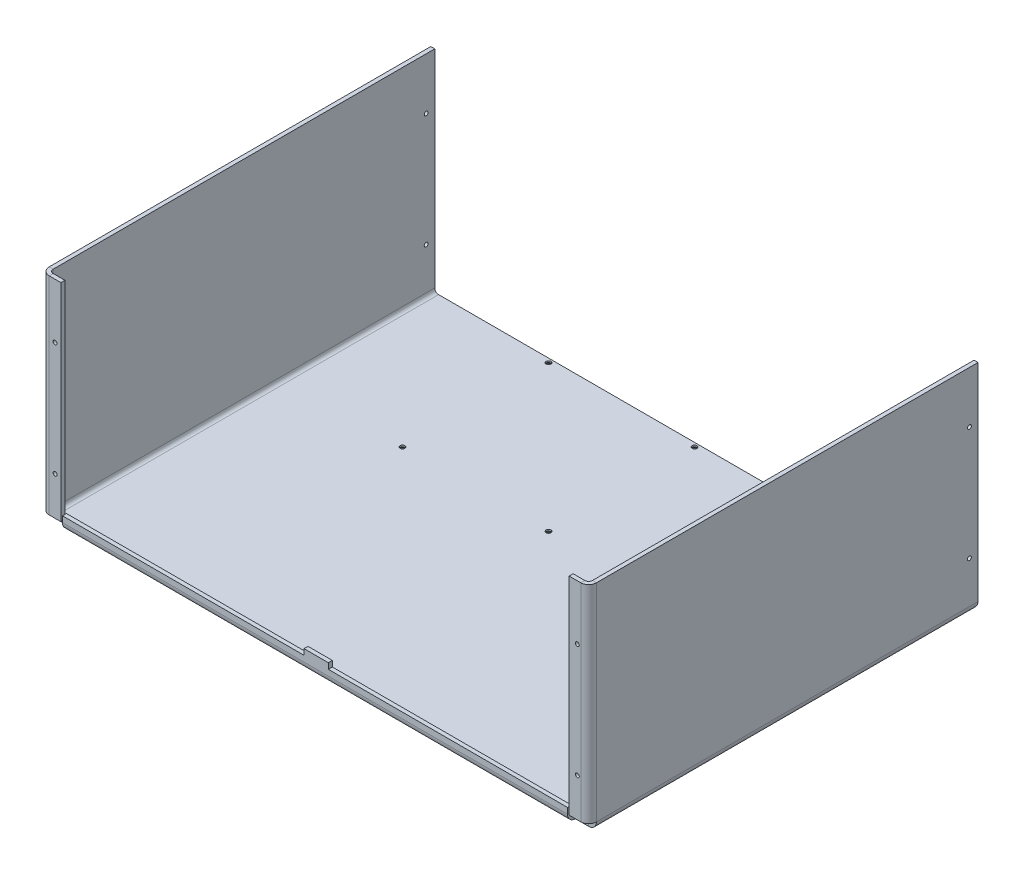
from build123d import *
from OCP.BRepAlgoAPI import BRepAlgoAPI_Cut
from OCP.TopTools import TopTools_ListOfShape

# Parameters (mm, degrees)
BASE_FLANGE1_DEPTH                                = 3.1241999999999996
SKETCHED_START                                    = -372.599383401
SKETCHED_BEND1_DEPTH                              = 304.8
SKETCHED_BEND1_2_DEPTH                            = 304.8
SKETCHED_BEND2_DEPTH                              = 304.8
SKETCHED_BEND2_2_DEPTH                            = 304.8
EDGE_FLANGE1_START                                = -1
EDGE_FLANGE1_DEPTH                                = 169.22392973
EDGE_FLANGE1_2_DEPTH                              = 7.124199914
EDGE_FLANGE1_START_2                              = 6.124199914
EDGE_FLANGE1_3_DEPTH                              = 162.099729816
EDGE_FLANGE2_START                                = -1
EDGE_FLANGE2_DEPTH                                = 169.223930078
EDGE_FLANGE2_2_DEPTH                              = 7.1242
EDGE_FLANGE2_START_2                              = 6.1242
EDGE_FLANGE2_3_DEPTH                              = 162.099730078
CUT_EXTRUDE1_DEPTH                                = 697.5074743358982
CUT_EXTRUDE2_DEPTH                                = 697.5074743358982
EDGE_FLANGE4_START                                = 152.995997641
EDGE_FLANGE4_DEPTH                                = 395.32508
EDGE_FLANGE4_START_2                              = 151.433897641
EDGE_FLANGE4_2_DEPTH                              = 1.5621
EDGE_FLANGE4_START_3                              = 548.321077641
EDGE_FLANGE4_3_DEPTH                              = 1.5621
EDGE_FLANGE4_4_DEPTH                              = 395.32508
SKETCH18_W                                        = 19.05000000000001
SKETCH18_H                                        = 4.495799999999319
TAB1_DEPTH                                        = 3.1241999999999996
CSK_FOR_8_FLAT_HEAD_MACHINE_SCREW_100_D           = 4.4958
CSK_FOR_8_FLAT_HEAD_MACHINE_SCREW_100_CSINK_D     = 8.4328
CSK_FOR_8_FLAT_HEAD_MACHINE_SCREW_100_CSINK_ANGLE = 100
LPATTERN1_COUNT                                   = 2
LPATTERN1_PITCH                                   = 65.99936
LPATTERN1_COUNT_DIR2                              = 2
LPATTERN1_PITCH_DIR2                              = 117.00001999999999
CSK_FOR_6_FLAT_HEAD_MACHINE_SCREW2_D              = 3.7973
CSK_FOR_6_FLAT_HEAD_MACHINE_SCREW2_CSINK_D        = 7.0866
CSK_FOR_6_FLAT_HEAD_MACHINE_SCREW2_CSINK_ANGLE    = 82
LPATTERN3_COUNT                                   = 2
LPATTERN3_PITCH                                   = 114.3
LPATTERN3_COUNT_DIR2                              = 2
LPATTERN3_PITCH_DIR2                              = 114.3
F_40_0_098_DIAMETER_HOLE1_D                       = 3.048
F_40_0_098_DIAMETER_HOLE1_DEPTH                   = 304.8
LPATTERN4_COUNT                                   = 2
LPATTERN4_PITCH                                   = 88.89999999999999
MIRROR2_COPY_1_D                                  = 3.048
MIRROR2_COPY_1_DEPTH                              = 304.8
MIRROR2_COPY_2_D                                  = 3.048
MIRROR2_COPY_2_DEPTH                              = 304.8
MIRROR2_COPY_3_D                                  = 3.048
MIRROR2_COPY_3_DEPTH                              = 304.8
MIRROR2_COPY_4_D                                  = 3.048
MIRROR2_COPY_4_DEPTH                              = 304.8
F_40_0_098_DIAMETER_HOLE2_D                       = 3.048
LPATTERN5_COUNT                                   = 2
LPATTERN5_PITCH                                   = 88.89999999999999


with BuildPart() as part:
    # Base-Flange1: sheet metal written as solids
    # Sketch1 → Base-Flange1 (new body)
    with BuildSketch(Plane(origin=(0, 0, 0), x_dir=(1, 0, 0), z_dir=(0, 1, 0))):
        Polygon((-26.655922359465325, 372.5993834011592), (727.9729976405347, 372.5993834011592), (727.9729976405347, 67.79938340115923), (-26.65592235946532, 67.79938340115915), align=None)
    extrude(amount=BASE_FLANGE1_DEPTH)

    # Sketched Bend1: read off the stored shape, not the designer's step
    # Sketched Bend1 outline → Sketched Bend1 (cut)
    with BuildSketch(Plane.XY.offset(SKETCHED_START)):
        with BuildLine():
            ThreePointArc((142.609937641, 1e-07), (139.516943564, 0.838444419), (137.270853036, 3.1242))
            Line((137.270853036, 3.1242), (-26.655922359, 3.1242))
            Line((-26.655922359, 3.1242), (-26.655922359, 0))
            Line((-26.655922359, 0), (142.609937641, 1e-07))
        make_face()
    extrude(amount=SKETCHED_BEND1_DEPTH, mode=Mode.SUBTRACT)

    # Sketched Bend1 2 outline → Sketched Bend1 2 (add)
    with BuildSketch(Plane.XY.offset(SKETCHED_START)):
        with BuildLine():
            Line((139.60993774, 6.1242), (139.609937641, 168.223930078))
            Line((139.609937641, 168.223930078), (136.485737641, 168.223930078))
            Line((136.485737641, 168.223930078), (136.48573774, 6.1242))
            ThreePointArc((136.48573774, 6.1242), (136.68526694, 4.573683471), (137.270853036, 3.1242))
            Line((137.270853036, 3.1242), (142.609937641, 3.1242001))
            ThreePointArc((142.609937641, 3.1242001), (140.488617368, 4.002879727), (139.60993774, 6.1242))
        make_face()
    extrude(amount=SKETCHED_BEND1_2_DEPTH)

    # Sketched Bend2: read off the stored shape, not the designer's step
    # Sketched Bend2 outline → Sketched Bend2 (cut)
    with BuildSketch(Plane.XY.offset(SKETCHED_START)):
        with BuildLine():
            Line((727.972997641, 3.1242), (564.046222808, 3.1242))
            ThreePointArc((564.046222808, 3.1242), (561.800132084, 0.838444066), (558.707137641, -3.91e-07))
            Line((558.707137641, -3.91e-07), (727.972997641, 0))
            Line((727.972997641, 0), (727.972997641, 3.1242))
        make_face()
    extrude(amount=SKETCHED_BEND2_DEPTH, mode=Mode.SUBTRACT)

    # Sketched Bend2 2 outline → Sketched Bend2 2 (add)
    with BuildSketch(Plane.XY.offset(SKETCHED_START)):
        with BuildLine():
            Line((564.831337641, 168.223930078), (561.707137641, 168.223930078))
            Line((561.707137641, 168.223930078), (561.707138032, 6.1242))
            ThreePointArc((561.707138032, 6.1242), (560.828458261, 4.00287938), (558.707137641, 3.124199609))
            Line((558.707137641, 3.124199609), (564.046222808, 3.1242))
            ThreePointArc((564.046222808, 3.1242), (564.631808851, 4.57368348), (564.831338032, 6.1242))
            Line((564.831338032, 6.1242), (564.831337641, 168.223930078))
        make_face()
    extrude(amount=SKETCHED_BEND2_2_DEPTH)

    # Edge-Flange1: read off the stored shape, not the designer's step
    # Edge-Flange1 outline → Edge-Flange1 (cut)
    with BuildSketch(Plane(origin=(0, 0, 0), x_dir=(1.0, 6.15831459901035e-10, 0), z_dir=(-6.15831459901035e-10, 1.0, 0)).offset(EDGE_FLANGE1_START)):
        with BuildLine():
            Line((142.609937744, 70.923583401), (142.609937641, 73.923583401))
            Line((142.609937641, 73.923583401), (139.609937744, 73.923583401))
            ThreePointArc((139.609937744, 73.923583401), (140.488617401, 71.802263058), (142.609937744, 70.923583401))
        make_face()
        with BuildLine():
            ThreePointArc((142.609937682, 67.799383401), (138.279474373, 69.593120074), (136.485737744, 73.923583401))
            Line((136.485737744, 73.923583401), (136.485737735, 67.799383401))
            Line((136.485737735, 67.799383401), (142.609937682, 67.799383401))
        make_face()
    extrude(amount=EDGE_FLANGE1_DEPTH, mode=Mode.SUBTRACT)

    # Edge-Flange1 2 outline → Edge-Flange1 2 (cut)
    with BuildSketch(Plane(origin=(0, 0, 0), x_dir=(1.0, 6.15831459901035e-10, 0), z_dir=(-6.15831459901035e-10, 1.0, 0)).offset(EDGE_FLANGE1_START)):
        with BuildLine():
            Line((142.609937682, 67.799383401), (142.609937744, 70.923583401))
            ThreePointArc((142.609937744, 70.923583401), (140.488617401, 71.802263058), (139.609937744, 73.923583401))
            Line((139.609937744, 73.923583401), (136.485737744, 73.923583401))
            ThreePointArc((136.485737744, 73.923583401), (138.279474373, 69.593120074), (142.609937682, 67.799383401))
        make_face()
    extrude(amount=EDGE_FLANGE1_2_DEPTH, mode=Mode.SUBTRACT)

    # Edge-Flange1 3 outline → Edge-Flange1 3 (add)
    with BuildSketch(Plane(origin=(0, 0, 0), x_dir=(1.0, 6.15831459901035e-10, 0), z_dir=(-6.15831459901035e-10, 1.0, 0)).offset(EDGE_FLANGE1_START_2)):
        with BuildLine():
            Line((151.725737744, 70.923583401), (142.609937744, 70.923583401))
            ThreePointArc((142.609937744, 70.923583401), (140.488617401, 71.802263058), (139.609937744, 73.923583401))
            Line((139.609937744, 73.923583401), (139.609937735, 68.584498687))
            ThreePointArc((139.609937735, 68.584498687), (141.059421212, 67.998912598), (142.609937744, 67.799383401))
            Line((142.609937744, 67.799383401), (151.725737744, 67.799383401))
            Line((151.725737744, 67.799383401), (151.725737744, 70.923583401))
        make_face()
    extrude(amount=EDGE_FLANGE1_3_DEPTH)


with BuildPart() as edge_flange2_tool:
    # Edge-Flange2: read off the stored shape, not the designer's step
    # Edge-Flange2 outline → Edge-Flange2 (new body)
    with BuildSketch(Plane(origin=(0, 0, 0), x_dir=(1, 0, 0), z_dir=(0, 1, 0)).offset(EDGE_FLANGE2_START)):
        with BuildLine():
            Line((558.707137641, 67.799383401), (564.831337641, 67.799383401))
            Line((564.831337641, 67.799383401), (564.831337641, 73.923583401))
            ThreePointArc((564.831337641, 73.923583401), (563.03760099, 69.593120052), (558.707137641, 67.799383401))
        make_face()
        with BuildLine():
            Line((558.707137641, 73.923583401), (558.707137641, 70.923583401))
            ThreePointArc((558.707137641, 70.923583401), (560.828457984, 71.802263058), (561.707137641, 73.923583401))
            Line((561.707137641, 73.923583401), (558.707137641, 73.923583401))
        make_face()
    extrude(amount=EDGE_FLANGE2_DEPTH)


with BuildPart() as part_1:
    add(part.part)

    # Edge-Flange2: cut by edge_flange2_tool, with a tolerance
    edge_flange2_stock = TopTools_ListOfShape()
    edge_flange2_stock.Append(part_1.part.wrapped)
    edge_flange2_tools = TopTools_ListOfShape()
    edge_flange2_tools.Append(edge_flange2_tool.part.wrapped)
    edge_flange2_cut = BRepAlgoAPI_Cut()
    edge_flange2_cut.SetArguments(edge_flange2_stock)
    edge_flange2_cut.SetTools(edge_flange2_tools)
    edge_flange2_cut.SetFuzzyValue(0.00001)
    edge_flange2_cut.Build()
    add(Compound.cast(edge_flange2_cut.Shape()).solids(), mode=Mode.REPLACE)


with BuildPart() as edge_flange2_2_tool:
    # Edge-Flange2 2 outline → Edge-Flange2 2 (new body)
    with BuildSketch(Plane(origin=(0, 0, 0), x_dir=(1, 0, 0), z_dir=(0, 1, 0)).offset(EDGE_FLANGE2_START)):
        with BuildLine():
            Line((558.707137641, 70.923583401), (558.707137641, 67.799383401))
            ThreePointArc((558.707137641, 67.799383401), (563.03760099, 69.593120052), (564.831337641, 73.923583401))
            Line((564.831337641, 73.923583401), (561.707137641, 73.923583401))
            ThreePointArc((561.707137641, 73.923583401), (560.828457984, 71.802263058), (558.707137641, 70.923583401))
        make_face()
    extrude(amount=EDGE_FLANGE2_2_DEPTH)


with BuildPart() as part_2:
    add(part_1.part)

    # Edge-Flange2 2: cut by edge_flange2_2_tool, with a tolerance
    edge_flange2_2_stock = TopTools_ListOfShape()
    edge_flange2_2_stock.Append(part_2.part.wrapped)
    edge_flange2_2_tools = TopTools_ListOfShape()
    edge_flange2_2_tools.Append(edge_flange2_2_tool.part.wrapped)
    edge_flange2_2_cut = BRepAlgoAPI_Cut()
    edge_flange2_2_cut.SetArguments(edge_flange2_2_stock)
    edge_flange2_2_cut.SetTools(edge_flange2_2_tools)
    edge_flange2_2_cut.SetFuzzyValue(0.00001)
    edge_flange2_2_cut.Build()
    add(Compound.cast(edge_flange2_2_cut.Shape()).solids(), mode=Mode.REPLACE)


with BuildPart() as edge_flange2_3_tool:
    # Edge-Flange2 3 outline → Edge-Flange2 3 (new body)
    with BuildSketch(Plane(origin=(0, 0, 0), x_dir=(1, 0, 0), z_dir=(0, 1, 0)).offset(EDGE_FLANGE2_START_2)):
        with BuildLine():
            Line((549.591337641, 67.799383401), (558.707137641, 67.799383401))
            ThreePointArc((558.707137641, 67.799383401), (560.257654168, 67.998912597), (561.707137641, 68.584498682))
            Line((561.707137641, 68.584498682), (561.707137641, 73.923583401))
            ThreePointArc((561.707137641, 73.923583401), (560.828457984, 71.802263058), (558.707137641, 70.923583401))
            Line((558.707137641, 70.923583401), (549.591337641, 70.923583401))
            Line((549.591337641, 70.923583401), (549.591337641, 67.799383401))
        make_face()
    extrude(amount=EDGE_FLANGE2_3_DEPTH)


with BuildPart() as part_3:
    add(part_2.part)


with BuildPart() as part_4:
    # Edge-Flange2 3: joined with edge_flange2_3_tool
    add(part_3.part.fuse(edge_flange2_3_tool.part, tol=0.00001))

    # Sketch10 → Cut-Extrude1 (cut, through all)
    with BuildSketch(Plane(origin=(0, 3.1241999999999996, 0), x_dir=(-1, 0, 0), z_dir=(0, 1, 0))):
        Polygon((-142.60993764053464, -67.79938340115915), (-152.99599764053465, -67.79938340115915), (-152.99599764053463, -73.92332340115915), (-142.6099376405346, -73.92332340115917), align=None)
    extrude(amount=-CUT_EXTRUDE1_DEPTH, mode=Mode.SUBTRACT)

    # Sketch11 → Cut-Extrude2 (cut, through all)
    with BuildSketch(Plane(origin=(0, 3.1241999999999996, 0), x_dir=(-1, 0, 0), z_dir=(0, 1, 0))):
        Polygon((-558.7071376405341, -67.79938340115922), (-548.3210776405342, -67.7993834011592), (-548.3210776405341, -73.92332340115921), (-558.7071376405341, -73.92332340115921), align=None)
    extrude(amount=-CUT_EXTRUDE2_DEPTH, mode=Mode.SUBTRACT)

    # Edge-Flange4: read off the stored shape, not the designer's step
    # Edge-Flange4 outline → Edge-Flange4 (cut)
    with BuildSketch(Plane.YZ.offset(EDGE_FLANGE4_START)):
        with BuildLine():
            Line((-3.91e-07, -67.799383401), (6e-09, -73.923323401))
            ThreePointArc((6e-09, -73.923323401), (0.838510004, -70.830477048), (3.1242, -68.584498682))
            Line((3.1242, -68.584498682), (3.1242, -67.799383401))
            Line((3.1242, -67.799383401), (-3.91e-07, -67.799383401))
        make_face()
    extrude(amount=EDGE_FLANGE4_DEPTH, mode=Mode.SUBTRACT)

    # Edge-Flange4 2 outline → Edge-Flange4 2 (cut)
    with BuildSketch(Plane.YZ.offset(EDGE_FLANGE4_START_2)):
        Polygon((0, -75.485683401), (3.1242, -75.485683401), (3.1242, -73.923323401), (-3.91e-07, -73.923323401), align=None)
    extrude(amount=EDGE_FLANGE4_2_DEPTH, mode=Mode.SUBTRACT)

    # Edge-Flange4 3 outline → Edge-Flange4 3 (cut)
    with BuildSketch(Plane.YZ.offset(EDGE_FLANGE4_START_3)):
        Polygon((0, -75.485683401), (3.1242, -75.485683401), (3.1242, -73.923323401), (-3.91e-07, -73.923323401), align=None)
    extrude(amount=EDGE_FLANGE4_3_DEPTH, mode=Mode.SUBTRACT)

    # Edge-Flange4 4 outline → Edge-Flange4 4 (add)
    with BuildSketch(Plane.YZ.offset(EDGE_FLANGE4_START)):
        with BuildLine():
            Line((3.1242, -68.584498682), (3.124200011, -73.923323401))
            ThreePointArc((3.124200011, -73.923323401), (4.002971582, -71.802171136), (6.1242, -70.923583401))
            Line((6.1242, -70.923583401), (10.7442, -70.923583401))
            Line((10.7442, -70.923583401), (10.7442, -67.799383401))
            Line((10.7442, -67.799383401), (6.1242, -67.799383401))
            ThreePointArc((6.1242, -67.799383401), (4.573683473, -67.998912597), (3.1242, -68.584498682))
        make_face()
    extrude(amount=EDGE_FLANGE4_4_DEPTH)

    # Tab1: sheet metal written as solids
    # Sketch18 → Tab1 (add)
    with BuildSketch(Plane.XY.offset(-67.79938340115912)):
        with Locations((351.5871676405345, 12.99209999999966)):
            Rectangle(SKETCH18_W, SKETCH18_H)
    extrude(amount=-TAB1_DEPTH)

    # CSK for #8 Flat Head Machine Screw (100)1 (through all)
    with Locations(Plane(origin=(533.307137641, 0, -347.199383401), x_dir=(0, 0, -1), z_dir=(0, -1, 0))):
        with Locations((0, 0)):
            csk_for_8_flat_head_machine_screw_100 = CounterSinkHole(CSK_FOR_8_FLAT_HEAD_MACHINE_SCREW_100_D / 2, CSK_FOR_8_FLAT_HEAD_MACHINE_SCREW_100_CSINK_D / 2, counter_sink_angle=CSK_FOR_8_FLAT_HEAD_MACHINE_SCREW_100_CSINK_ANGLE)

    # LPattern1: CSK for _8 Flat Head Machine Screw _100 2 × 2
    with Locations(*[(-j * LPATTERN1_PITCH_DIR2, 0, i * LPATTERN1_PITCH) for i in range(LPATTERN1_COUNT) for j in range(LPATTERN1_COUNT_DIR2) if (i, j) != (0, 0)]):
        add(csk_for_8_flat_head_machine_screw_100, mode=Mode.SUBTRACT)

    # CSK for #6 Flat Head Machine Screw2 (through all)
    with Locations(Plane(origin=(346.125225558, 0, -369.424383401), x_dir=(0, 0, -1), z_dir=(0, -1, 0))):
        with Locations((0, 0)):
            csk_for_6_flat_head_machine_screw2 = CounterSinkHole(CSK_FOR_6_FLAT_HEAD_MACHINE_SCREW2_D / 2, CSK_FOR_6_FLAT_HEAD_MACHINE_SCREW2_CSINK_D / 2, counter_sink_angle=CSK_FOR_6_FLAT_HEAD_MACHINE_SCREW2_CSINK_ANGLE)

    # LPattern3: CSK for _6 Flat Head Machine Screw2 2 × 2
    with Locations(*[(-i * LPATTERN3_PITCH, 0, j * LPATTERN3_PITCH_DIR2) for i in range(LPATTERN3_COUNT) for j in range(LPATTERN3_COUNT_DIR2) if (i, j) != (0, 0)]):
        add(csk_for_6_flat_head_machine_screw2, mode=Mode.SUBTRACT)

    # #40 (0.098) Diameter Hole1
    with Locations(Plane.XY.offset(-67.79938340115964)):
        with Locations((147.167707641, 125.23443008)):
            f_40_0_098_diameter_hole1 = Hole(F_40_0_098_DIAMETER_HOLE1_D / 2, depth=F_40_0_098_DIAMETER_HOLE1_DEPTH)

    # LPattern4: #40 (0.098) Diameter Hole1 ×2
    with Locations(*[(0, -i * LPATTERN4_PITCH, 0) for i in range(1, LPATTERN4_COUNT)]):
        add(f_40_0_098_diameter_hole1, mode=Mode.SUBTRACT)

    # Mirror1: #40 (0.098) Diameter Hole1 across plane
    add(f_40_0_098_diameter_hole1.mirror(Plane(origin=(351.5871676405346, 15.239999999999316, -70.92358340115912), x_dir=(0, 0, 1), z_dir=(-1, 0, 0))), mode=Mode.SUBTRACT)

    # Mirror2 copy 1
    with Locations(Plane(origin=(703.1743352263219, -88.89999999999998, -67.79938340115964), x_dir=(-1, 0, 0), z_dir=(0, 0, 1))):
        with Locations((147.167707641, -125.23443008)):
            Hole(MIRROR2_COPY_1_D / 2, depth=MIRROR2_COPY_1_DEPTH)

    # Mirror2 copy 2
    with Locations(Plane(origin=(703.1743352810689, 1.161e-14, -67.79938340115964), x_dir=(-1, 0, 0), z_dir=(0, 0, 1))):
        with Locations((147.167707641, -125.23443008)):
            Hole(MIRROR2_COPY_2_D / 2, depth=MIRROR2_COPY_2_DEPTH)

    # Mirror2 copy 3
    with Locations(Plane.XY.offset(-67.79938340115964)):
        with Locations((147.167707641, 125.23443008)):
            Hole(MIRROR2_COPY_3_D / 2, depth=MIRROR2_COPY_3_DEPTH)

    # Mirror2 copy 4
    with Locations(Plane(origin=(703.1743352810689, 1.161e-14, -67.79938340115964), x_dir=(-1, 0, 0), z_dir=(0, 0, 1))):
        with Locations((147.167707641, -125.23443008)):
            Hole(MIRROR2_COPY_4_D / 2, depth=MIRROR2_COPY_4_DEPTH)

    # #40 (0.098) Diameter Hole2 (through all)
    with Locations(Plane(origin=(564.831337641, 38.850211002, -365.881083401), x_dir=(0, 1, 0), z_dir=(1, 0, 0))):
        with Locations((0, 0)):
            f_40_0_098_diameter_hole2 = Hole(F_40_0_098_DIAMETER_HOLE2_D / 2)

    # LPattern5: #40 (0.098) Diameter Hole2 ×2
    with Locations(*[(0, i * LPATTERN5_PITCH, 0) for i in range(1, LPATTERN5_COUNT)]):
        add(f_40_0_098_diameter_hole2, mode=Mode.SUBTRACT)


solid = part_4.part
